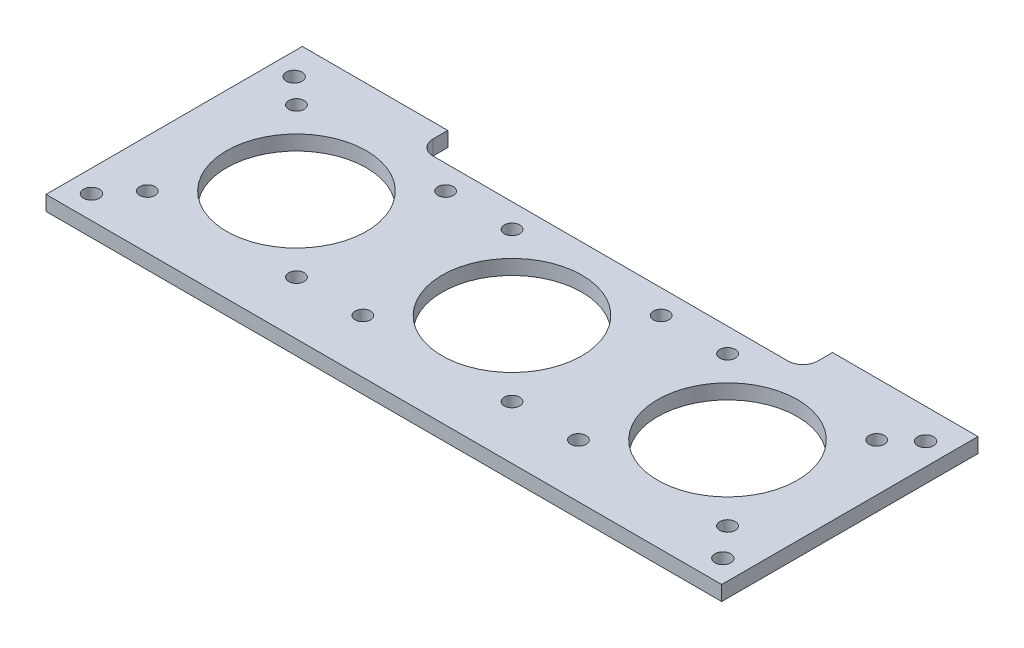
from build123d import *

# Parameters (mm, degrees)
SKETCH1_W           = 145
SKETCH1_H           = 55
BOSS_EXTRUDE1_DEPTH = 3.175
SKETCH4_R           = 1.651
SKETCH4_R_2         = 15
SKETCH4_R_3         = 1.69999914
CUT_EXTRUDE1_DEPTH  = 156.113122027


with BuildPart() as part:
    # Sketch1 → Boss-Extrude1 (new body)
    with BuildSketch(Plane(origin=(0, 0, 0), x_dir=(1, 0, 0), z_dir=(0, 1, 0))):
        with Locations((72.5, 27.5)):
            Rectangle(SKETCH1_W, SKETCH1_H)
    extrude(amount=BOSS_EXTRUDE1_DEPTH)

    # Sketch4 → Cut-Extrude1 (cut, through all)
    with BuildSketch(Plane.XZ):
        with Locations((10.25, -11.5)):
            Circle(SKETCH4_R)
        with Locations((10.25, -43.5)):
            Circle(SKETCH4_R)
        with Locations((42.25, -43.5)):
            Circle(SKETCH4_R)
        with Locations((26.25, -27.5)):
            Circle(SKETCH4_R_2)
        with Locations((42.25, -11.5)):
            Circle(SKETCH4_R)
        with Locations((56.5, -11.5)):
            Circle(SKETCH4_R)
        with Locations((56.5, -43.5)):
            Circle(SKETCH4_R)
        with Locations((88.5, -43.5)):
            Circle(SKETCH4_R)
        with Locations((88.5, -11.5)):
            Circle(SKETCH4_R)
        with Locations((72.5, -27.5)):
            Circle(SKETCH4_R_2)
        with Locations((102.75, -11.5)):
            Circle(SKETCH4_R)
        with Locations((102.75, -43.5)):
            Circle(SKETCH4_R)
        with Locations((134.75, -43.5)):
            Circle(SKETCH4_R)
        with Locations((134.75, -11.5)):
            Circle(SKETCH4_R)
        with Locations((118.75, -27.5)):
            Circle(SKETCH4_R_2)
        with Locations((4.749998796, -5.00000808)):
            Circle(SKETCH4_R_3)
        with Locations((4.750000369, -48.50000744)):
            Circle(SKETCH4_R_3)
        with Locations((140.249999576, -5.00000318)):
            Circle(SKETCH4_R_3)
        with Locations((140.250001149, -48.50000254)):
            Circle(SKETCH4_R_3)
        with BuildLine():
            Line((113.775, -51.825), (113.775, -55))
            Line((113.775, -55), (31.225, -55))
            Line((31.225, -55), (31.225, -51.825))
            ThreePointArc((31.225, -51.825), (32.15493597, -49.57993597), (34.4, -48.65))
            Line((34.4, -48.65), (110.6, -48.65))
            ThreePointArc((110.6, -48.65), (112.84506403, -49.57993597), (113.775, -51.825))
        make_face()
    extrude(amount=-CUT_EXTRUDE1_DEPTH, mode=Mode.SUBTRACT)


solid = part.part
